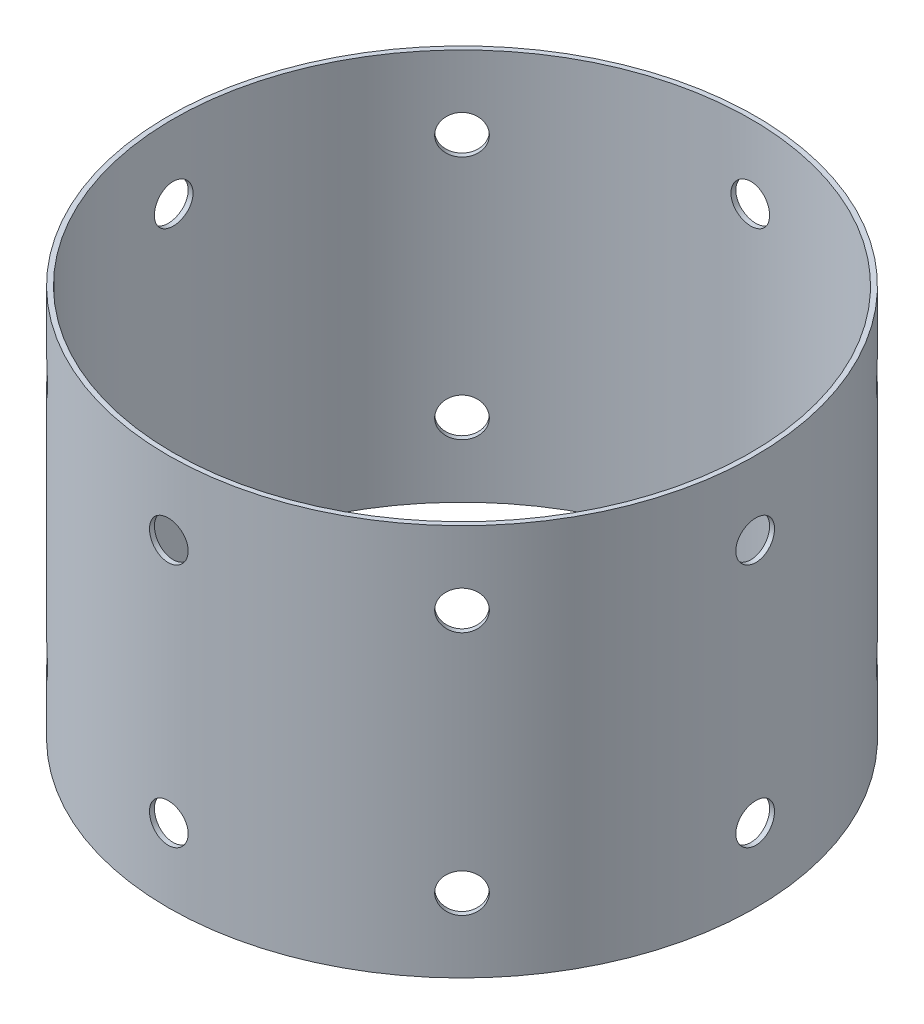
from build123d import *

# Parameters (mm, degrees)
SKETCH2_R                              = 76.2
SKETCH2_R_2                            = 74.93
BOSS_EXTRUDE1_DEPTH                    = 101.6
LOX_TO_KERO_LOX_SIDE_HOLES_REACH       = 168.559
LOX_TO_KERO_LOX_SIDE_HOLES_END_RADIUS  = 76.2
SKETCH3_R                              = 5.0165
CIRPATTERN1_COUNT                      = 8
LOX_TO_KERO_KERO_SIDE_HOLES_REACH      = 168.559
LOX_TO_KERO_KERO_SIDE_HOLES_END_RADIUS = 76.2
SKETCH4_R                              = 5.0165
CIRPATTERN2_COUNT                      = 8


with BuildPart() as part:
    # Sketch2 → Boss-Extrude1 (new body)
    with BuildSketch(Plane(origin=(0, 0, 0), x_dir=(1, 0, 0), z_dir=(0, 1, 0))):
        Circle(SKETCH2_R)
        Circle(SKETCH2_R_2, mode=Mode.SUBTRACT)
    extrude(amount=BOSS_EXTRUDE1_DEPTH)

    # LOX to Kero, LOX Side Holes: up to this cylinder (the profile starts inside it)
    lox_to_kero_lox_side_holes_end = Plane(origin=(0, 82.55, 0), z_dir=(0, -1, 0)) * Cylinder(LOX_TO_KERO_LOX_SIDE_HOLES_END_RADIUS, 490.518, mode=Mode.PRIVATE)
    # Sketch3 → LOX to Kero, LOX Side Holes (cut, up to the surface)
    with BuildSketch(Plane(origin=(0, 127, 0), x_dir=(0, 0, -1), z_dir=(1, 0, 0)), mode=Mode.PRIVATE) as lox_to_kero_lox_side_holes_sk1:
        with Locations((0, -44.45)):
            Circle(SKETCH3_R)
    lox_to_kero_lox_side_holes_tool1 = extrude(lox_to_kero_lox_side_holes_sk1.sketch, amount=LOX_TO_KERO_LOX_SIDE_HOLES_REACH, mode=Mode.PRIVATE) & lox_to_kero_lox_side_holes_end
    lox_to_kero_lox_side_holes = lox_to_kero_lox_side_holes_tool1.solids().sort_by_distance((0, 82.55, 0))[0]
    add(lox_to_kero_lox_side_holes, mode=Mode.SUBTRACT)

    # CirPattern1: LOX to Kero, LOX Side Holes ×8 about axis
    cirpattern1_axis = Axis((0, 101.6, 0), (0, 1, 0))
    for i in range(1, CIRPATTERN1_COUNT):
        add(lox_to_kero_lox_side_holes.rotate(cirpattern1_axis, i * 360 / CIRPATTERN1_COUNT), mode=Mode.SUBTRACT)

    # LOX to Kero, Kero Side Holes: up to this cylinder (the profile starts inside it)
    lox_to_kero_kero_side_holes_end = Plane(origin=(0, 19.05, 0), z_dir=(0, -1, 0)) * Cylinder(LOX_TO_KERO_KERO_SIDE_HOLES_END_RADIUS, 490.518, mode=Mode.PRIVATE)
    # Sketch4 → LOX to Kero, Kero Side Holes (cut, up to the surface)
    with BuildSketch(Plane(origin=(0, -25.4, 0), x_dir=(0, 0, 1), z_dir=(1, 0, 0)), mode=Mode.PRIVATE) as lox_to_kero_kero_side_holes_sk1:
        with Locations((0, -44.45)):
            Circle(SKETCH4_R)
    lox_to_kero_kero_side_holes_tool1 = extrude(lox_to_kero_kero_side_holes_sk1.sketch, amount=LOX_TO_KERO_KERO_SIDE_HOLES_REACH, mode=Mode.PRIVATE) & lox_to_kero_kero_side_holes_end
    lox_to_kero_kero_side_holes = lox_to_kero_kero_side_holes_tool1.solids().sort_by_distance((0, 19.05, 0))[0]
    add(lox_to_kero_kero_side_holes, mode=Mode.SUBTRACT)

    # CirPattern2: LOX to Kero, Kero Side Holes ×8 about axis
    cirpattern2_axis = Axis((0, 0, 0), (0, 1, 0))
    for i in range(1, CIRPATTERN2_COUNT):
        add(lox_to_kero_kero_side_holes.rotate(cirpattern2_axis, i * 360 / CIRPATTERN2_COUNT), mode=Mode.SUBTRACT)


solid = part.part
